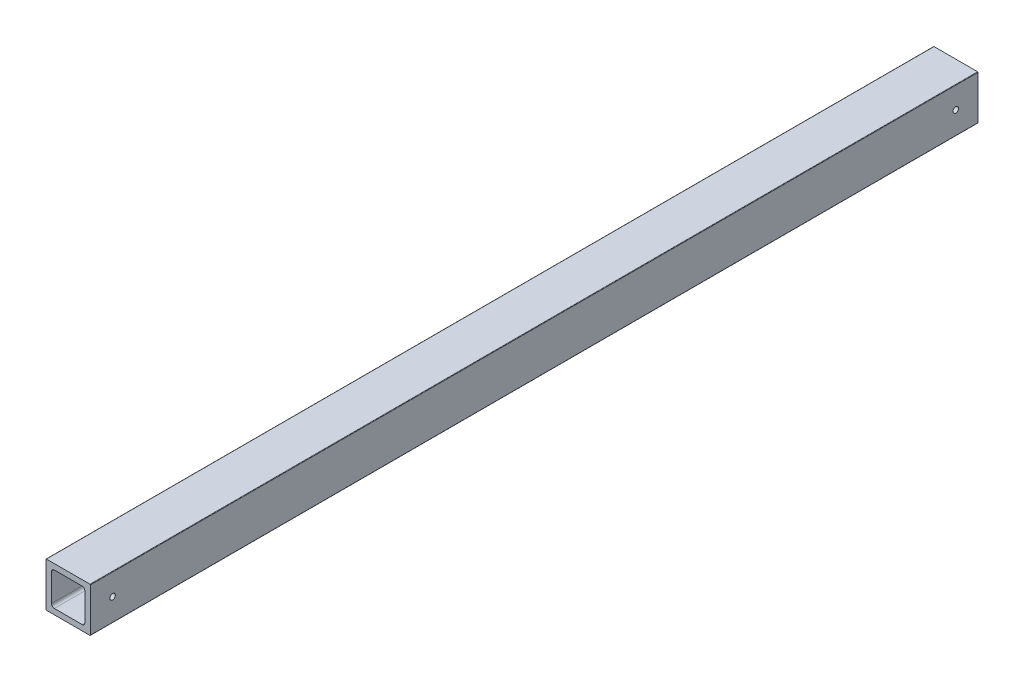
from build123d import *

# Parameters (mm, degrees)
BOSS_EXTRUDE1_DEPTH = 508
SKETCH2_R           = 1.5875
CUT_EXTRUDE1_DEPTH  = 510.268416456


with BuildPart() as part:
    # Sketch1 → Boss-Extrude1 (new body)
    with BuildSketch(Plane(origin=(0, 0, 0), x_dir=(-1, 0, 0), z_dir=(0, 0, -1))):
        with BuildLine():
            Line((0, 0.254), (0, 25.146))
            ThreePointArc((0, 25.146), (-0.074394878, 25.325605122), (-0.254, 25.4))
            Line((-0.254, 25.4), (-25.146, 25.4))
            ThreePointArc((-25.146, 25.4), (-25.325605122, 25.325605122), (-25.4, 25.146))
            Line((-25.4, 25.146), (-25.4, 0.254))
            ThreePointArc((-25.4, 0.254), (-25.325605122, 0.074394878), (-25.146, 0))
            Line((-25.146, 0), (-0.254, 0))
            ThreePointArc((-0.254, 0), (-0.074394878, 0.074394878), (0, 0.254))
        make_face()
        with BuildLine():
            Line((-3.175, 20.6375), (-3.175, 4.7625))
            ThreePointArc((-3.175, 4.7625), (-3.639967985, 3.639967985), (-4.7625, 3.175))
            Line((-4.7625, 3.175), (-20.6375, 3.175))
            ThreePointArc((-20.6375, 3.175), (-21.760032015, 3.639967985), (-22.225, 4.7625))
            Line((-22.225, 4.7625), (-22.225, 20.6375))
            ThreePointArc((-22.225, 20.6375), (-21.760032015, 21.760032015), (-20.6375, 22.225))
            Line((-20.6375, 22.225), (-4.7625, 22.225))
            ThreePointArc((-4.7625, 22.225), (-3.639967985, 21.760032015), (-3.175, 20.6375))
        make_face(mode=Mode.SUBTRACT)
    extrude(amount=-BOSS_EXTRUDE1_DEPTH)

    # Sketch2 → Cut-Extrude1 (cut, through all)
    with BuildSketch(Plane.ZY):
        with Locations((12.697459746, 12.954)):
            Circle(SKETCH2_R)
        with Locations((495.3, 12.954)):
            Circle(SKETCH2_R)
    extrude(amount=-CUT_EXTRUDE1_DEPTH, mode=Mode.SUBTRACT)


solid = part.part
